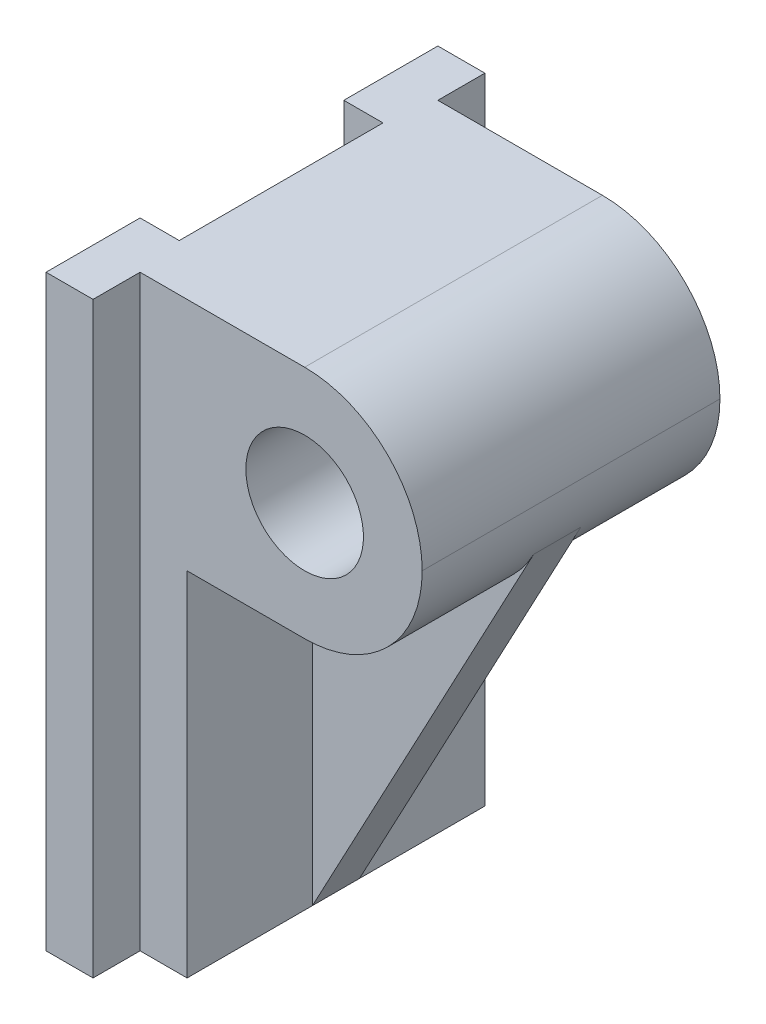
from build123d import *

# Parameters (mm, degrees)
BOSS_EXTRUDE1_DEPTH = 150
SKETCH2_W           = 60
SKETCH2_H           = 60
SKETCH2_R           = 15
BOSS_EXTRUDE2_DEPTH = 76
FILLET1_R           = 30
RIB4_REACH          = 181.042
SKETCH5_WALL_W      = 480.08378995
SKETCH5_WALL_H      = 12


with BuildPart() as part:
    # Sketch1 → Boss-Extrude1 (new body)
    with BuildSketch(Plane(origin=(0, 0, 0), x_dir=(1, 0, 0), z_dir=(0, 1, 0))):
        Polygon((0, 50), (0, 26), (10, 26), (10, -26), (0, -26), (0, -50), (12, -50), (12, -38), (24, -38), (24, 38), (12, 38), (12, 50), align=None)
    extrude(amount=BOSS_EXTRUDE1_DEPTH)

    # Sketch2 → Boss-Extrude2 (add)
    with BuildSketch(Plane(origin=(0, 0, -38), x_dir=(-1, 0, 0), z_dir=(0, 0, -1))):
        with Locations((-54, 120)):
            Rectangle(SKETCH2_W, SKETCH2_H)
        with Locations((-54, 120)):
            Circle(SKETCH2_R, mode=Mode.SUBTRACT)
    extrude(amount=-BOSS_EXTRUDE2_DEPTH)

    # Fillet1
    fillet1_edges = [part.edges().sort_by_distance(p)[0] for p in [
        (84, 150, 0),
        (84, 90, 0),
    ]]
    fillet(fillet1_edges, radius=FILLET1_R - 0.0001)  # a hair under: the kernel refuses the full size

    # Sketch5 wall → Rib4 (add, up to next)
    with BuildSketch(Plane(origin=(52.235294323, 52.941176856, 0), x_dir=(0.470588235292, 0.882352941178, 0), z_dir=(-0.882352941178, 0.470588235292, 0)), mode=Mode.PRIVATE) as rib4_sk1:
        Rectangle(SKETCH5_WALL_W, SKETCH5_WALL_H)
    rib4_tool1 = extrude(rib4_sk1.sketch, amount=RIB4_REACH, mode=Mode.PRIVATE) - part.part
    add(rib4_tool1.solids().sort_by_distance((52.235294323, 52.941176856, 0))[0])


solid = part.part
